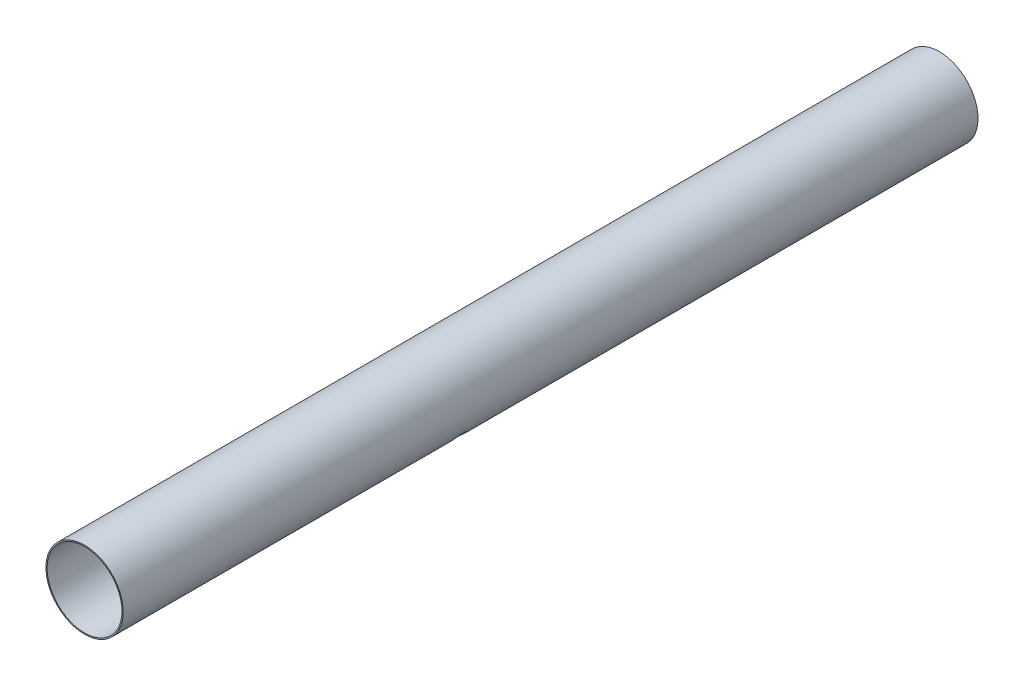
from build123d import *

# Parameters (mm, degrees)
SKETCH1_R           = 78.6
SKETCH1_R_2         = 76.2
BOSS_EXTRUDE1_DEPTH = 1740
SKETCH5_R           = 15
CUT_EXTRUDE2_DEPTH  = 1744.546936564


with BuildPart() as part:
    # Sketch1 → Boss-Extrude1 (new body)
    with BuildSketch(Plane.XY):
        Circle(SKETCH1_R)
        Circle(SKETCH1_R_2, mode=Mode.SUBTRACT)
    extrude(amount=BOSS_EXTRUDE1_DEPTH)

    # Sketch5 → Cut-Extrude2 (cut, through all)
    with BuildSketch(Plane(origin=(0, 0, 0), x_dir=(0, 0, -1), z_dir=(0.7071067811865489, -0.7071067811865462, 0))):
        with Locations((-1034.89, 0)):
            Circle(SKETCH5_R)
    extrude(amount=CUT_EXTRUDE2_DEPTH, mode=Mode.SUBTRACT)


solid = part.part
